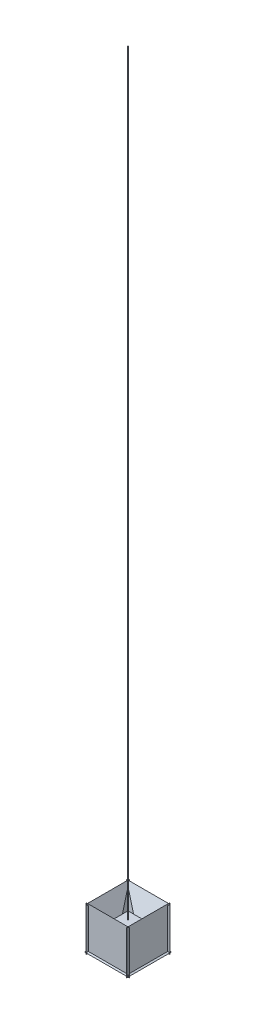
from build123d import *

# Parameters (mm, degrees)
SKETCH1_W           = 203.2
SKETCH1_H           = 203.2
BOSS_EXTRUDE1_DEPTH = 101.6
LOFT1_OUTLINE_W     = 575.560177182
LOFT1_OUTLINE_H     = 575.560177182
LOFT1_DEPTH         = 166.149911615
LOFT1_TAPER         = 60
CIRPATTERN1_COUNT   = 3
CIRPATTERN1_ANGLE   = 180
CIRPATTERN2_COUNT   = 4
SKETCH7_R           = 5
BOSS_EXTRUDE2_DEPTH = 10000


# Read off the part's stored shape, not the designer's step: Loft1
with BuildPart() as part:
    # Sketch1 → Boss-Extrude1 (new, symmetric)
    with BuildSketch(Plane(origin=(0, 0, 0), x_dir=(1, 0, 0), z_dir=(0, 1, 0))):
        Rectangle(SKETCH1_W, SKETCH1_H)
    extrude(amount=BOSS_EXTRUDE1_DEPTH, both=True)

    # Sketch7 → Boss-Extrude2 (add)
    with BuildSketch(Plane(origin=(0, 101.6, 0), x_dir=(1, 0, 0), z_dir=(0, 1, 0))):
        with Locations(Location((0, 0, 0), (0, 0, 90))):
            Circle(SKETCH7_R)
    extrude(amount=BOSS_EXTRUDE2_DEPTH)


with BuildPart() as body_2:
    # Loft1 outline → Loft1 (new body)
    with BuildSketch(Plane.XY.offset(-267.749911615)):
        Rectangle(LOFT1_OUTLINE_W, LOFT1_OUTLINE_H)
    extrude(amount=LOFT1_DEPTH, taper=LOFT1_TAPER)


with BuildPart() as cirpattern1_1:
    # CirPattern1: pattern copy
    add(body_2.part.rotate(Axis((0, 0, 0), (-1, 0, 0)), 1 * CIRPATTERN1_ANGLE / (CIRPATTERN1_COUNT - 1)))


with BuildPart() as cirpattern1_2:
    # CirPattern1: pattern copy
    add(body_2.part.rotate(Axis((0, 0, 0), (-1, 0, 0)), 2 * CIRPATTERN1_ANGLE / (CIRPATTERN1_COUNT - 1)))


with BuildPart() as cirpattern2_1:
    # CirPattern2: pattern copy
    add(body_2.part.rotate(Axis((0, 0, 0), (0, 1, 0)), 1 * 360 / CIRPATTERN2_COUNT))


with BuildPart() as cirpattern2_2:
    # CirPattern2: pattern copy
    add(body_2.part.rotate(Axis((0, 0, 0), (0, 1, 0)), 2 * 360 / CIRPATTERN2_COUNT))


with BuildPart() as cirpattern2_3:
    # CirPattern2: pattern copy
    add(body_2.part.rotate(Axis((0, 0, 0), (0, 1, 0)), 3 * 360 / CIRPATTERN2_COUNT))


solid = Compound([part.part, body_2.part, cirpattern1_1.part, cirpattern1_2.part, cirpattern2_1.part, cirpattern2_2.part, cirpattern2_3.part])
